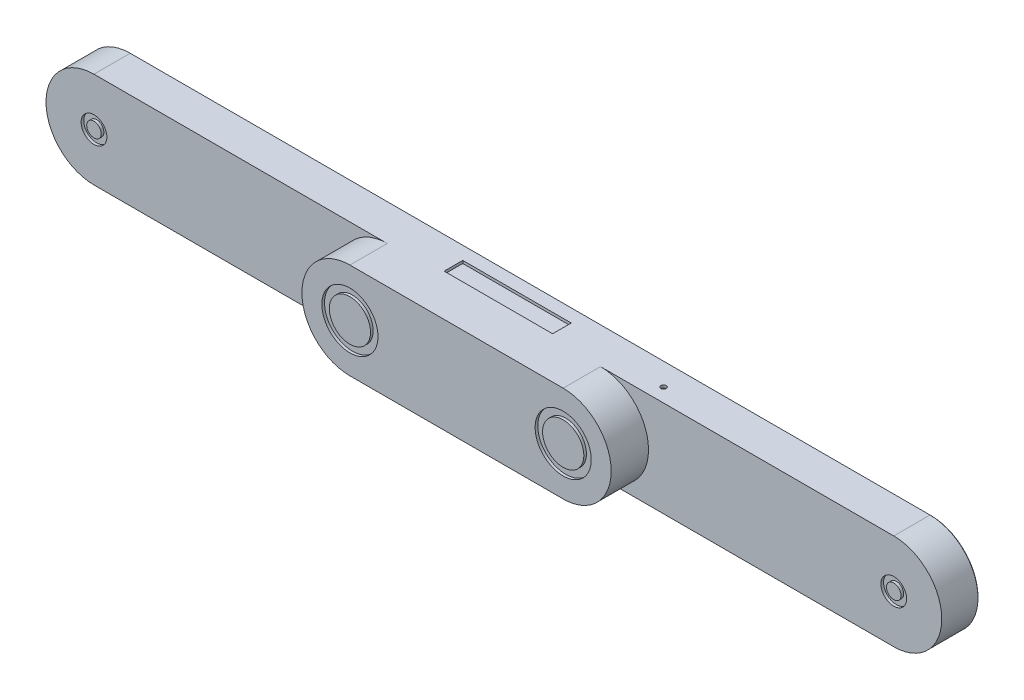
from build123d import *

# Parameters (mm, degrees)
EXTRUDE_1_DEPTH               = 7
EXTRUDE_2_DEPTH               = 7
SKETCH_3_R                    = 5.263772199
SKETCH_3_R_2                  = 3.86516819
CUT_EXTRUDE_1_DEPTH           = 0.5
SKETCH_4_R                    = 2.413361855
SKETCH_4_R_2                  = 1.363684761
CUT_EXTRUDE_2_DEPTH           = 0.5
SKETCH_5_R                    = 0.5
SKETCH_5_W                    = 20.341295444
SKETCH_5_H                    = 3.489253995
CUT_EXTRUDE_3_DEPTH           = 0.5
SKETCH_6_R                    = 1
CUT_EXTRUDE_4_DEPTH           = 5
CUT_EXTRUDE_5_DEPTH           = 0.5
CUT_EXTRUDE_5_DRAFT           = -45
CUT_EXTRUDE_5_PROFILE_2_DEPTH = 0.5
CUT_EXTRUDE_5_PROFILE_2_DRAFT = -45
CUT_EXTRUDE_5_PROFILE_3_DEPTH = 0.5
CUT_EXTRUDE_5_PROFILE_3_DRAFT = -45
CUT_EXTRUDE_5_PROFILE_4_DEPTH = 0.5
CUT_EXTRUDE_5_PROFILE_4_DRAFT = -45
CUT_EXTRUDE_5_PROFILE_5_DEPTH = 0.5
CUT_EXTRUDE_5_PROFILE_5_DRAFT = -45
CUT_EXTRUDE_5_PROFILE_6_DEPTH = 0.5
CUT_EXTRUDE_5_PROFILE_6_DRAFT = -45
WRAP_START                    = -0.01
WRAP_1_DEPTH                  = 0.01
CHAMFER_1_SIZE                = 0.2


# Read off the part's stored shape, not the designer's step: 包覆1
with BuildPart() as part:
    # 草图1 → 凸台-拉伸1 (new body)
    with BuildSketch(Plane.XY):
        with BuildLine():
            Line((-75, 9), (75, 9))
            ThreePointArc((75, 9), (84, 0), (75, -9))
            Line((75, -9), (-75, -9))
            ThreePointArc((-75, -9), (-84, 0), (-75, 9))
        make_face()
    extrude(amount=EXTRUDE_1_DEPTH)

    # 草图2 → 凸台-拉伸2 (add)
    with BuildSketch(Plane.XY.offset(7)):
        with BuildLine():
            Line((-20, 9), (20, 9))
            ThreePointArc((20, 9), (29, 0), (20, -9))
            Line((20, -9), (-20, -9))
            ThreePointArc((-20, -9), (-29, 0), (-20, 9))
        make_face()
    extrude(amount=EXTRUDE_2_DEPTH)

    # 草图3 → 切除-拉伸1 (cut)
    # profile 1 of 2: a face of its own
    with BuildSketch(Plane.XY.offset(14)):
        with Locations((-20, 0)):
            Circle(SKETCH_3_R)
        with Locations((-20, 0)):
            Circle(SKETCH_3_R_2, mode=Mode.SUBTRACT)
    # profile 2 of 2: a face of its own
    with BuildSketch(Plane.XY.offset(14)):
        with Locations(Location((20, 0, 0), (0, 0, 180))):
            Circle(SKETCH_3_R)
        with Locations(Location((20, 0, 0), (0, 0, 180))):
            Circle(SKETCH_3_R_2, mode=Mode.SUBTRACT)
    extrude(amount=-CUT_EXTRUDE_1_DEPTH, mode=Mode.SUBTRACT)

    # 草图4 → 切除-拉伸2 (cut)
    # profile 1 of 2: a face of its own
    with BuildSketch(Plane.XY.offset(7)):
        with Locations((-75, 0)):
            Circle(SKETCH_4_R)
        with Locations((-75, 0)):
            Circle(SKETCH_4_R_2, mode=Mode.SUBTRACT)
    # profile 2 of 2: a face of its own
    with BuildSketch(Plane.XY.offset(7)):
        with Locations(Location((75, 0, 0), (0, 0, 180))):
            Circle(SKETCH_4_R)
        with Locations(Location((75, 0, 0), (0, 0, 180))):
            Circle(SKETCH_4_R_2, mode=Mode.SUBTRACT)
    extrude(amount=-CUT_EXTRUDE_2_DEPTH, mode=Mode.SUBTRACT)

    # 草图5 → 切除-拉伸3 (cut)
    with BuildSketch(Plane(origin=(0, 9, 0), x_dir=(1, 0, 0), z_dir=(0, 1, 0))):
        with Locations(Location((29.23037992, -4.408801646, 0), (0, 0, 180))):
            Circle(SKETCH_5_R)
        with Locations((0, -4.408801646)):
            Rectangle(SKETCH_5_W, SKETCH_5_H)
    extrude(amount=-CUT_EXTRUDE_3_DEPTH, mode=Mode.SUBTRACT)

    # 草图6 → 切除-拉伸4 (cut)
    with BuildSketch(Plane(origin=(0, 0, 0), x_dir=(-1, 0, 0), z_dir=(0, 0, -1))):
        with Locations((-65, 6)):
            Circle(SKETCH_6_R)
        with Locations(Location((65, 6, 0), (0, 0, 180))):
            Circle(SKETCH_6_R)
        with Locations((65, -6)):
            Circle(SKETCH_6_R)
        with Locations(Location((-65, -6, 0), (0, 0, 180))):
            Circle(SKETCH_6_R)
    extrude(amount=-CUT_EXTRUDE_4_DEPTH, mode=Mode.SUBTRACT)


with BuildPart() as cut_extrude_5_tool:
    # 草图7 → 切除-拉伸5 (with draft: the straight prism first)
    with BuildSketch(Plane(origin=(0, 0, 0), x_dir=(-1, 0, 0), z_dir=(0, 0, -1))):
        Polygon((-74.422649731, -1), (-73.845299462, 0), (-74.422649731, 1), (-75.577350269, 1), (-76.154700538, 0), (-75.577350269, -1), align=None)
    extrude(amount=-CUT_EXTRUDE_5_DEPTH)
    # 切除-拉伸5: the draft: its side faces are tilted about the plane it starts from
    cut_extrude_5_sides = [cut_extrude_5_tool.faces().sort_by_distance(p)[0] for p in [
        (74.133974596, -0.5, 0.25),
        (74.133974596, 0.5, 0.25),
        (75, 1, 0.25),
        (75.866025404, 0.5, 0.25),
        (75.866025404, -0.5, 0.25),
        (75, -1, 0.25),
    ]]
    draft(cut_extrude_5_sides, Plane(origin=(0, 0, 0), x_dir=(-1, 0, 0), z_dir=(0, 0, -1)), CUT_EXTRUDE_5_DRAFT)


with BuildPart() as part_1:
    add(part.part)

    # 切除-拉伸5: cut by cut_extrude_5_tool
    add(cut_extrude_5_tool.part, mode=Mode.SUBTRACT)


with BuildPart() as cut_extrude_5_profile_2_tool:
    # 草图7 → 切除-拉伸5 profile 2 (with draft: the straight prism first)
    with BuildSketch(Plane(origin=(0, 0, 0), x_dir=(-1, 0, 0), z_dir=(0, 0, -1))):
        Polygon((42.135050103, -5.268835335), (43.289750642, -5.268835335), (43.867100911, -4.268835335), (43.289750642, -3.268835335), (42.135050103, -3.268835335), (41.557699834, -4.268835335), align=None)
    extrude(amount=-CUT_EXTRUDE_5_PROFILE_2_DEPTH)
    # 切除-拉伸5 profile 2: the draft: its side faces are tilted about the plane it starts from
    cut_extrude_5_profile_2_sides = [cut_extrude_5_profile_2_tool.faces().sort_by_distance(p)[0] for p in [
        (-42.712400373, -5.268835335, 0.25),
        (-43.578425776, -4.768835335, 0.25),
        (-43.578425776, -3.768835335, 0.25),
        (-42.712400373, -3.268835335, 0.25),
        (-41.846374969, -3.768835335, 0.25),
        (-41.846374969, -4.768835335, 0.25),
    ]]
    draft(cut_extrude_5_profile_2_sides, Plane(origin=(0, 0, 0), x_dir=(-1, 0, 0), z_dir=(0, 0, -1)), CUT_EXTRUDE_5_PROFILE_2_DRAFT)


with BuildPart() as part_2:
    add(part_1.part)

    # 切除-拉伸5 profile 2: cut by cut_extrude_5_profile_2_tool
    add(cut_extrude_5_profile_2_tool.part, mode=Mode.SUBTRACT)


with BuildPart() as cut_extrude_5_profile_3_tool:
    # 草图7 → 切除-拉伸5 profile 3 (with draft: the straight prism first)
    with BuildSketch(Plane(origin=(0, 0, 0), x_dir=(-1, 0, 0), z_dir=(0, 0, -1))):
        Polygon((-41.557699834, 5.451130792), (-42.135050103, 6.451130792), (-43.289750642, 6.451130792), (-43.867100911, 5.451130792), (-43.289750642, 4.451130792), (-42.135050103, 4.451130792), align=None)
    extrude(amount=-CUT_EXTRUDE_5_PROFILE_3_DEPTH)
    # 切除-拉伸5 profile 3: the draft: its side faces are tilted about the plane it starts from
    cut_extrude_5_profile_3_sides = [cut_extrude_5_profile_3_tool.faces().sort_by_distance(p)[0] for p in [
        (41.846374969, 5.951130792, 0.25),
        (42.712400373, 6.451130792, 0.25),
        (43.578425776, 5.951130792, 0.25),
        (43.578425776, 4.951130792, 0.25),
        (42.712400373, 4.451130792, 0.25),
        (41.846374969, 4.951130792, 0.25),
    ]]
    draft(cut_extrude_5_profile_3_sides, Plane(origin=(0, 0, 0), x_dir=(-1, 0, 0), z_dir=(0, 0, -1)), CUT_EXTRUDE_5_PROFILE_3_DRAFT)


with BuildPart() as part_3:
    add(part_2.part)

    # 切除-拉伸5 profile 3: cut by cut_extrude_5_profile_3_tool
    add(cut_extrude_5_profile_3_tool.part, mode=Mode.SUBTRACT)


with BuildPart() as cut_extrude_5_profile_4_tool:
    # 草图7 → 切除-拉伸5 profile 4 (with draft: the straight prism first)
    with BuildSketch(Plane(origin=(0, 0, 0), x_dir=(-1, 0, 0), z_dir=(0, 0, -1))):
        Polygon((-41.557699834, -4.268835335), (-42.135050103, -3.268835335), (-43.289750642, -3.268835335), (-43.867100911, -4.268835335), (-43.289750642, -5.268835335), (-42.135050103, -5.268835335), align=None)
    extrude(amount=-CUT_EXTRUDE_5_PROFILE_4_DEPTH)
    # 切除-拉伸5 profile 4: the draft: its side faces are tilted about the plane it starts from
    cut_extrude_5_profile_4_sides = [cut_extrude_5_profile_4_tool.faces().sort_by_distance(p)[0] for p in [
        (41.846374969, -3.768835335, 0.25),
        (42.712400373, -3.268835335, 0.25),
        (43.578425776, -3.768835335, 0.25),
        (43.578425776, -4.768835335, 0.25),
        (42.712400373, -5.268835335, 0.25),
        (41.846374969, -4.768835335, 0.25),
    ]]
    draft(cut_extrude_5_profile_4_sides, Plane(origin=(0, 0, 0), x_dir=(-1, 0, 0), z_dir=(0, 0, -1)), CUT_EXTRUDE_5_PROFILE_4_DRAFT)


with BuildPart() as part_4:
    add(part_3.part)

    # 切除-拉伸5 profile 4: cut by cut_extrude_5_profile_4_tool
    add(cut_extrude_5_profile_4_tool.part, mode=Mode.SUBTRACT)


with BuildPart() as cut_extrude_5_profile_5_tool:
    # 草图7 → 切除-拉伸5 profile 5 (with draft: the straight prism first)
    with BuildSketch(Plane(origin=(0, 0, 0), x_dir=(-1, 0, 0), z_dir=(0, 0, -1))):
        Polygon((42.135050103, 4.451130792), (43.289750642, 4.451130792), (43.867100911, 5.451130792), (43.289750642, 6.451130792), (42.135050103, 6.451130792), (41.557699834, 5.451130792), align=None)
    extrude(amount=-CUT_EXTRUDE_5_PROFILE_5_DEPTH)
    # 切除-拉伸5 profile 5: the draft: its side faces are tilted about the plane it starts from
    cut_extrude_5_profile_5_sides = [cut_extrude_5_profile_5_tool.faces().sort_by_distance(p)[0] for p in [
        (-42.712400373, 4.451130792, 0.25),
        (-43.578425776, 4.951130792, 0.25),
        (-43.578425776, 5.951130792, 0.25),
        (-42.712400373, 6.451130792, 0.25),
        (-41.846374969, 5.951130792, 0.25),
        (-41.846374969, 4.951130792, 0.25),
    ]]
    draft(cut_extrude_5_profile_5_sides, Plane(origin=(0, 0, 0), x_dir=(-1, 0, 0), z_dir=(0, 0, -1)), CUT_EXTRUDE_5_PROFILE_5_DRAFT)


with BuildPart() as part_5:
    add(part_4.part)

    # 切除-拉伸5 profile 5: cut by cut_extrude_5_profile_5_tool
    add(cut_extrude_5_profile_5_tool.part, mode=Mode.SUBTRACT)


with BuildPart() as cut_extrude_5_profile_6_tool:
    # 草图7 → 切除-拉伸5 profile 6 (with draft: the straight prism first)
    with BuildSketch(Plane(origin=(0, 0, 0), x_dir=(-1, 0, 0), z_dir=(0, 0, -1))):
        Polygon((75.577350269, -1), (76.154700538, 0), (75.577350269, 1), (74.422649731, 1), (73.845299462, 0), (74.422649731, -1), align=None)
    extrude(amount=-CUT_EXTRUDE_5_PROFILE_6_DEPTH)
    # 切除-拉伸5 profile 6: the draft: its side faces are tilted about the plane it starts from
    cut_extrude_5_profile_6_sides = [cut_extrude_5_profile_6_tool.faces().sort_by_distance(p)[0] for p in [
        (-75.866025404, -0.5, 0.25),
        (-75.866025404, 0.5, 0.25),
        (-75, 1, 0.25),
        (-74.133974596, 0.5, 0.25),
        (-74.133974596, -0.5, 0.25),
        (-75, -1, 0.25),
    ]]
    draft(cut_extrude_5_profile_6_sides, Plane(origin=(0, 0, 0), x_dir=(-1, 0, 0), z_dir=(0, 0, -1)), CUT_EXTRUDE_5_PROFILE_6_DRAFT)


with BuildPart() as part_6:
    add(part_5.part)

    # 切除-拉伸5 profile 6: cut by cut_extrude_5_profile_6_tool
    add(cut_extrude_5_profile_6_tool.part, mode=Mode.SUBTRACT)

    # 包覆1 outline → 包覆1 (cut)
    # profile 1 of 5: a face of its own
    with BuildSketch(Plane(origin=(0, 0, 0), x_dir=(-1, 0, 0), z_dir=(0, 0, -1)).offset(WRAP_START)):
        with BuildLine():
            add(Edge.make_bspline(
                [(-23.020357106, 0.2296875), (-23.02077942, 0.213405213), (-23.021588909, 0.182195475), (-23.034387077, 0.138032641), (-23.052112474, 0.097537483), (-23.079545966, 0.063665563), (-23.111521846, 0.034690041), (-23.150081733, 0.01514381), (-23.192908299, 0.001954286), (-23.223276263, 0.000669671), (-23.239107106, 0)],
                knots=[0, 0, 0, 0, 0.136554966, 0.261747299, 0.384490029, 0.506148384, 0.625808579, 0.745099071, 0.867119956, 1, 1, 1, 1], degree=3))
            Line((-23.020357106, 0.2296875), (-23.020357106, 1.054101563))
            add(Edge.make_bspline(
                [(-22.976607106, 2.130761719), (-22.976898943, 2.092477324), (-22.977515766, 2.011559843), (-22.981970866, 1.883485596), (-22.988739074, 1.742192064), (-22.998482125, 1.592089844), (-23.008225066, 1.441987624), (-23.014993568, 1.30069409), (-23.019439821, 1.172847582), (-23.020063129, 1.092158057), (-23.020357106, 1.054101563)],
                knots=[0, 0, 0, 0, 0.106568294, 0.225241589, 0.356692768, 0.500317122, 0.643941477, 0.775392656, 0.894065951, 1, 1, 1, 1], degree=3))
            add(Edge.make_bspline(
                [(-23.195357106, 2.3625), (-23.180029398, 2.361681405), (-23.150272562, 2.360092204), (-23.107452272, 2.348614336), (-23.069958003, 2.327140107), (-23.036717435, 2.299221779), (-23.010574637, 2.264023664), (-22.989550989, 2.224491642), (-22.979188744, 2.178889656), (-22.977489261, 2.147207199), (-22.976607106, 2.130761719)],
                knots=[0, 0, 0, 0, 0.128659322, 0.249776057, 0.367926716, 0.488665315, 0.611461807, 0.733780722, 0.86181299, 1, 1, 1, 1], degree=3))
            add(Edge.make_bspline(
                [(-23.414107106, 2.130761719), (-23.413324783, 2.147237619), (-23.411814963, 2.179034786), (-23.400105927, 2.224181223), (-23.380345551, 2.264231485), (-23.353912056, 2.299160837), (-23.320676085, 2.327386671), (-23.282884234, 2.348284407), (-23.240262216, 2.360216793), (-23.210698455, 2.361719967), (-23.195357106, 2.3625)],
                knots=[0, 0, 0, 0, 0.138263128, 0.266836758, 0.388367244, 0.511231377, 0.632036483, 0.751928691, 0.871269808, 1, 1, 1, 1], degree=3))
            add(Edge.make_bspline(
                [(-23.457857106, 1.054101563), (-23.457563129, 1.092158057), (-23.456939821, 1.172847582), (-23.452493568, 1.30069409), (-23.445725066, 1.441987624), (-23.435982125, 1.592089844), (-23.426239074, 1.742192064), (-23.419470866, 1.883485596), (-23.415015766, 2.011559843), (-23.414398943, 2.092477324), (-23.414107106, 2.130761719)],
                knots=[0, 0, 0, 0, 0.105934049, 0.224607344, 0.356058523, 0.499682878, 0.643307232, 0.774758411, 0.893431706, 1, 1, 1, 1], degree=3))
            Line((-23.457857106, 1.054101563), (-23.457857106, 0.2296875))
            add(Edge.make_bspline(
                [(-23.239107106, 0), (-23.254481565, 0.000684186), (-23.284173123, 0.002005504), (-23.326296562, 0.015258877), (-23.364672413, 0.03489429), (-23.397349768, 0.06338985), (-23.424550816, 0.097744845), (-23.443368006, 0.137830526), (-23.4557219, 0.182254536), (-23.457124817, 0.213419919), (-23.457857106, 0.2296875)],
                knots=[0, 0, 0, 0, 0.129477122, 0.250049616, 0.369727711, 0.491233762, 0.613287415, 0.737253567, 0.86285268, 1, 1, 1, 1], degree=3))
        make_face()
    # profile 2 of 5: a face of its own
    with BuildSketch(Plane(origin=(0, 0, 0), x_dir=(-1, 0, 0), z_dir=(0, 0, -1)).offset(WRAP_START)):
        with BuildLine():
            add(Edge.make_bspline(
                [(-23.414107106, 3.19375), (-23.413347731, 3.211434059), (-23.411867695, 3.245900612), (-23.395473731, 3.294900877), (-23.371566906, 3.340438497), (-23.337181288, 3.380120785), (-23.296500556, 3.413523606), (-23.251207645, 3.438524463), (-23.201772241, 3.453693272), (-23.167663885, 3.455385526), (-23.150239918, 3.45625)],
                knots=[0, 0, 0, 0, 0.128029489, 0.249531812, 0.371776588, 0.499838197, 0.628113743, 0.75260336, 0.873619514, 1, 1, 1, 1], degree=3))
            add(Edge.make_bspline(
                [(-23.150239918, 2.93125), (-23.167672624, 2.932098476), (-23.201798087, 2.933759414), (-23.251004184, 2.949125124), (-23.296702982, 2.973151039), (-23.337124526, 3.006765669), (-23.371804036, 3.046465998), (-23.395296056, 3.092469619), (-23.41189757, 3.141582776), (-23.413357861, 3.176060308), (-23.414107106, 3.19375)],
                knots=[0, 0, 0, 0, 0.126295102, 0.247229495, 0.37085115, 0.49904003, 0.62701512, 0.750636775, 0.87205701, 1, 1, 1, 1], degree=3))
            add(Edge.make_bspline(
                [(-22.889107106, 3.19375), (-22.889949949, 3.176094422), (-22.891589466, 3.141750422), (-22.906855603, 3.092111942), (-22.931659317, 3.046908122), (-22.965243458, 3.00670324), (-23.005049219, 2.973438535), (-23.049753589, 2.948800807), (-23.098710354, 2.933812992), (-23.132816885, 2.932116592), (-23.150239918, 2.93125)],
                knots=[0, 0, 0, 0, 0.128580339, 0.250117168, 0.375142405, 0.502686137, 0.630229869, 0.75153893, 0.873075759, 1, 1, 1, 1], degree=3))
            add(Edge.make_bspline(
                [(-23.150239918, 3.45625), (-23.132826046, 3.455367153), (-23.098737449, 3.453638931), (-23.049543554, 3.438849682), (-23.005256565, 3.413238488), (-22.965185343, 3.380184124), (-22.931894188, 3.339994786), (-22.906681016, 3.295260552), (-22.89162003, 3.245732255), (-22.889960327, 3.211399696), (-22.889107106, 3.19375)],
                knots=[0, 0, 0, 0, 0.127006889, 0.248622858, 0.370818088, 0.498444872, 0.626071655, 0.749719966, 0.871335935, 1, 1, 1, 1], degree=3))
        make_face()
    # profile 3 of 5: a face of its own
    with BuildSketch(Plane(origin=(0, 0, 0), x_dir=(-1, 0, 0), z_dir=(0, 0, -1)).offset(WRAP_START)):
        with BuildLine():
            add(Edge.make_bspline(
                [(-24.857857106, 2.115722656), (-24.857185546, 2.134271695), (-24.855866262, 2.170711388), (-24.841965292, 2.223173898), (-24.821469194, 2.272859239), (-24.792252472, 2.317720704), (-24.757578211, 2.357003874), (-24.716343083, 2.386068331), (-24.669779652, 2.403242994), (-24.637195218, 2.405237344), (-24.620650075, 2.40625)],
                knots=[0, 0, 0, 0, 0.133605296, 0.262468371, 0.389256972, 0.520213318, 0.647129901, 0.765314104, 0.880835377, 1, 1, 1, 1], degree=3))
            Line((-24.857857106, 2.115722656), (-24.770357106, 0.863378906))
            add(Edge.make_bspline(
                [(-24.682857106, -0.49765625), (-24.68281773, -0.485579222), (-24.682731544, -0.459144673), (-24.683513306, -0.416074288), (-24.684923101, -0.366628187), (-24.686784706, -0.31054986), (-24.690708155, -0.248389646), (-24.693574257, -0.179291331), (-24.698961766, -0.104157122), (-24.703137277, -0.022286977), (-24.709978299, 0.06582207), (-24.715425178, 0.16069307), (-24.723656254, 0.262010898), (-24.730537796, 0.369870135), (-24.739807068, 0.483986202), (-24.749306041, 0.604531562), (-24.759584476, 0.731678352), (-24.76670401, 0.818718059), (-24.770357106, 0.863378906)],
                knots=[0, 0, 0, 0, 0.026559892, 0.058135061, 0.09473128, 0.135350644, 0.181522645, 0.23169825, 0.287434184, 0.347171742, 0.411974657, 0.481777591, 0.556149408, 0.635519609, 0.719461507, 0.807938991, 0.901451789, 1, 1, 1, 1], degree=3))
            add(Edge.make_bspline(
                [(-24.751900075, -0.725292969), (-24.735164789, -0.687749612), (-24.702618667, -0.614736772), (-24.689318364, -0.535937008), (-24.682857106, -0.49765625)],
                knots=[0, 0, 0, 0, 0.514202122, 1, 1, 1, 1], degree=3))
            add(Edge.make_bspline(
                [(-24.923482106, -0.875), (-24.906879682, -0.873063067), (-24.87264626, -0.869069201), (-24.826303271, -0.836949663), (-24.784698801, -0.788660782), (-24.763532236, -0.747766544), (-24.751900075, -0.725292969)],
                knots=[0, 0, 0, 0, 0.206442947, 0.425675725, 0.68437804, 1, 1, 1, 1], degree=3))
            add(Edge.make_bspline(
                [(-25.129927418, -0.756738281), (-25.115144422, -0.774768252), (-25.087198841, -0.80885187), (-25.036063759, -0.846865826), (-24.981014509, -0.870550056), (-24.942615148, -0.873520121), (-24.923482106, -0.875)],
                knots=[0, 0, 0, 0, 0.282637376, 0.534293935, 0.767955151, 1, 1, 1, 1], degree=3))
            add(Edge.make_bspline(
                [(-25.258443043, -0.525683594), (-25.251262582, -0.540551477), (-25.235302139, -0.573599212), (-25.206233092, -0.626768478), (-25.170687445, -0.68898978), (-25.144151168, -0.733096546), (-25.129927418, -0.756738281)],
                knots=[0, 0, 0, 0, 0.187244695, 0.416200011, 0.687076471, 1, 1, 1, 1], degree=3))
            add(Edge.make_bspline(
                [(-25.540767262, -0.21875), (-25.529227649, -0.219719951), (-25.505292827, -0.221731768), (-25.470225508, -0.237765003), (-25.435155588, -0.262083282), (-25.400305386, -0.296567712), (-25.36463347, -0.340102887), (-25.328984609, -0.393464428), (-25.292517482, -0.455939142), (-25.270211728, -0.501595142), (-25.258443043, -0.525683594)],
                knots=[0, 0, 0, 0, 0.079356062, 0.164595917, 0.261818615, 0.372983349, 0.501380608, 0.649604883, 0.815128879, 1, 1, 1, 1], degree=3))
            add(Edge.make_bspline(
                [(-25.776607106, -0.452539062), (-25.7756382, -0.436951726), (-25.773750186, -0.406578174), (-25.760210674, -0.362570934), (-25.737049115, -0.322494545), (-25.705788579, -0.286688951), (-25.668711132, -0.257226844), (-25.628550051, -0.234548763), (-25.585379923, -0.22094648), (-25.555670902, -0.219483772), (-25.540767262, -0.21875)],
                knots=[0, 0, 0, 0, 0.127319193, 0.248094732, 0.372380767, 0.503087844, 0.634271763, 0.757647368, 0.878422908, 1, 1, 1, 1], degree=3))
            add(Edge.make_bspline(
                [(-25.749263356, -0.566699219), (-25.757219009, -0.546677094), (-25.771835849, -0.509890649), (-25.775113441, -0.470493248), (-25.776607106, -0.452539062)],
                knots=[0, 0, 0, 0, 0.544279933, 1, 1, 1, 1], degree=3))
            add(Edge.make_bspline(
                [(-24.931685231, -1.35625), (-24.951761835, -1.355465467), (-24.991874949, -1.353897968), (-25.051604775, -1.345173151), (-25.109606513, -1.329081158), (-25.166768931, -1.30770544), (-25.222206698, -1.279613876), (-25.276969826, -1.245965377), (-25.329559053, -1.205050027), (-25.381328498, -1.158610219), (-25.432397462, -1.106389869), (-25.481337458, -1.047356906), (-25.529295839, -0.982319738), (-25.57538773, -0.910935533), (-25.621703356, -0.83425804), (-25.665743929, -0.750760503), (-25.708983715, -0.661204659), (-25.735617875, -0.598714702), (-25.749263356, -0.566699219)],
                knots=[0, 0, 0, 0, 0.050001857, 0.099903856, 0.149857419, 0.199588227, 0.2515965, 0.304332927, 0.359362785, 0.417215033, 0.477390357, 0.541017716, 0.607960101, 0.678450054, 0.752487111, 0.830906338, 0.913368236, 1, 1, 1, 1], degree=3))
            add(Edge.make_bspline(
                [(-24.434028981, -1.074609375), (-24.451093022, -1.097118397), (-24.484136398, -1.140705614), (-24.540358067, -1.197742891), (-24.598330285, -1.246536282), (-24.659200035, -1.287211951), (-24.723578913, -1.317842377), (-24.790682403, -1.339743766), (-24.860190287, -1.35433697), (-24.907685468, -1.355607825), (-24.931685231, -1.35625)],
                knots=[0, 0, 0, 0, 0.142277619, 0.275511097, 0.40274525, 0.523824621, 0.643550251, 0.760893153, 0.879177055, 1, 1, 1, 1], degree=3))
            add(Edge.make_bspline(
                [(-24.245357106, -0.49765625), (-24.245820313, -0.523886339), (-24.246737399, -0.575818219), (-24.2559728, -0.652870799), (-24.270943389, -0.727811127), (-24.291692928, -0.801200577), (-24.318175187, -0.872543043), (-24.350715303, -0.942203439), (-24.388737761, -1.010130619), (-24.418836052, -1.052979991), (-24.434028981, -1.074609375)],
                knots=[0, 0, 0, 0, 0.127395181, 0.252224509, 0.376418895, 0.498382539, 0.622389267, 0.745722041, 0.871646298, 1, 1, 1, 1], degree=3))
            Line((-24.245357106, -0.49765625), (-24.304146168, 0.91328125))
            Line((-24.304146168, 0.91328125), (-24.376607106, 2.231933594))
            add(Edge.make_bspline(
                [(-24.620650075, 2.40625), (-24.607360202, 2.405612507), (-24.580114793, 2.40430559), (-24.539783767, 2.392605466), (-24.499379293, 2.37463504), (-24.461361827, 2.349606437), (-24.426780098, 2.322511365), (-24.399920248, 2.293606531), (-24.381815936, 2.263537988), (-24.378292071, 2.242157062), (-24.376607106, 2.231933594)],
                knots=[0, 0, 0, 0, 0.123979978, 0.254169887, 0.389534908, 0.536050561, 0.678405439, 0.799029224, 0.903904144, 1, 1, 1, 1], degree=3))
        make_face()
    # profile 4 of 5: a face of its own
    with BuildSketch(Plane(origin=(0, 0, 0), x_dir=(-1, 0, 0), z_dir=(0, 0, -1)).offset(WRAP_START)):
        with BuildLine():
            add(Edge.make_bspline(
                [(-24.945357106, 3.192382812), (-24.944502419, 3.210039175), (-24.942829271, 3.244603561), (-24.927617283, 3.29432555), (-24.903604531, 3.340090508), (-24.869869201, 3.380113379), (-24.82981285, 3.413477932), (-24.785044049, 3.438672537), (-24.735744882, 3.453670059), (-24.701644292, 3.455377678), (-24.684224293, 3.45625)],
                knots=[0, 0, 0, 0, 0.128187465, 0.250941881, 0.374799753, 0.501953779, 0.629107805, 0.752298096, 0.873463572, 1, 1, 1, 1], degree=3))
            add(Edge.make_bspline(
                [(-24.684224293, 2.93125), (-24.701644162, 2.932122396), (-24.735744497, 2.933830159), (-24.785045524, 2.948826628), (-24.82980713, 2.974025306), (-24.869891313, 3.007374103), (-24.903392954, 3.047300666), (-24.927633676, 3.092446644), (-24.942754751, 3.14130154), (-24.944480955, 3.175184958), (-24.945357106, 3.192382812)],
                knots=[0, 0, 0, 0, 0.127345465, 0.249285638, 0.373263572, 0.501230583, 0.629197595, 0.752375772, 0.874315945, 1, 1, 1, 1], degree=3))
            add(Edge.make_bspline(
                [(-24.420357106, 3.192382812), (-24.421174625, 3.175169463), (-24.422788498, 3.141188423), (-24.438841479, 3.092393157), (-24.463720946, 3.047265833), (-24.49789487, 3.007320875), (-24.538560717, 2.974211204), (-24.583384201, 2.948801184), (-24.632709016, 2.933836804), (-24.666806091, 2.932124643), (-24.684224293, 2.93125)],
                knots=[0, 0, 0, 0, 0.125226972, 0.247211779, 0.370738834, 0.499308974, 0.628093898, 0.751620954, 0.87311766, 1, 1, 1, 1], degree=3))
            add(Edge.make_bspline(
                [(-24.684224293, 3.45625), (-24.66680596, 3.455375433), (-24.63270863, 3.453663422), (-24.583385679, 3.438697952), (-24.53855496, 3.413292163), (-24.497917358, 3.380165975), (-24.463507559, 3.340129712), (-24.438856435, 3.294378533), (-24.422710861, 3.244715979), (-24.421151927, 3.210054788), (-24.420357106, 3.192382812)],
                knots=[0, 0, 0, 0, 0.126081118, 0.24681061, 0.369557631, 0.497529319, 0.625287579, 0.749482307, 0.872273785, 1, 1, 1, 1], degree=3))
        make_face()
    # profile 5 of 5: a face of its own
    with BuildSketch(Plane(origin=(0, 0, 0), x_dir=(-1, 0, 0), z_dir=(0, 0, -1)).offset(WRAP_START)):
        with BuildLine():
            add(Edge.make_bspline(
                [(-26.126607106, 1.371972656), (-26.126307613, 1.310447664), (-26.125726327, 1.191033979), (-26.122321867, 1.017838975), (-26.116883169, 0.856265882), (-26.109674865, 0.706274063), (-26.099434164, 0.567931802), (-26.087109309, 0.441214986), (-26.073448871, 0.32617071), (-26.060823971, 0.253796386), (-26.054829762, 0.219433594)],
                knots=[0, 0, 0, 0, 0.159648833, 0.30986197, 0.449483198, 0.579135829, 0.699492038, 0.809394599, 0.909501967, 1, 1, 1, 1], degree=3))
            add(Edge.make_bspline(
                [(-26.096528981, 2.045996094), (-26.105301765, 1.933714752), (-26.122829924, 1.709374887), (-26.125348879, 1.484365573), (-26.126607106, 1.371972656)],
                knots=[0, 0, 0, 0, 0.500496606, 1, 1, 1, 1], degree=3))
            add(Edge.make_bspline(
                [(-25.995357106, 3.452832031), (-25.995611145, 3.438477141), (-25.996151476, 3.40794495), (-25.996447131, 3.359161273), (-25.998862977, 3.304484415), (-26.001572609, 3.243645795), (-26.004755415, 3.176622849), (-26.010069132, 3.103765973), (-26.014312955, 3.024859918), (-26.020888305, 2.939908868), (-26.027512402, 2.848975821), (-26.035176089, 2.751915824), (-26.04335508, 2.649147445), (-26.052039267, 2.539962673), (-26.06276424, 2.424970923), (-26.072460631, 2.303886082), (-26.084505451, 2.177022785), (-26.092451386, 2.090431775), (-26.096528981, 2.045996094)],
                knots=[0, 0, 0, 0, 0.030530485, 0.064936935, 0.103728168, 0.146896636, 0.194444284, 0.246401946, 0.302228311, 0.362470542, 0.427580771, 0.496109891, 0.569507596, 0.646808102, 0.729018946, 0.815091692, 0.905111088, 1, 1, 1, 1], degree=3))
            add(Edge.make_bspline(
                [(-26.217525075, 3.675), (-26.200162771, 3.674406448), (-26.16737153, 3.673285439), (-26.12118784, 3.663336278), (-26.082311801, 3.645174421), (-26.04926843, 3.621088675), (-26.025182685, 3.588045305), (-26.007020828, 3.549169266), (-25.997071667, 3.502985576), (-25.995950658, 3.470194334), (-25.995357106, 3.452832031)],
                knots=[0, 0, 0, 0, 0.14458455, 0.27306901, 0.390274216, 0.5, 0.609725784, 0.72693099, 0.85541545, 1, 1, 1, 1], degree=3))
            add(Edge.make_bspline(
                [(-26.439693043, 3.469921875), (-26.436808492, 3.486017187), (-26.431297149, 3.516769561), (-26.415002049, 3.558632289), (-26.395673206, 3.595230078), (-26.369536526, 3.624718635), (-26.338494987, 3.647500507), (-26.302359142, 3.663541934), (-26.261538499, 3.673104616), (-26.232618135, 3.674350036), (-26.217525075, 3.675)],
                knots=[0, 0, 0, 0, 0.145840897, 0.278649698, 0.399944032, 0.513972316, 0.627654313, 0.74162799, 0.865159915, 1, 1, 1, 1], degree=3))
            add(Edge.make_bspline(
                [(-26.520357106, 2.164257812), (-26.517437564, 2.241733381), (-26.51184712, 2.390086402), (-26.503160757, 2.602705352), (-26.49367194, 2.795718927), (-26.483378486, 2.968886284), (-26.473189388, 3.12225036), (-26.463099916, 3.255816014), (-26.452727562, 3.369616215), (-26.443747024, 3.438724929), (-26.439693043, 3.469921875)],
                knots=[0, 0, 0, 0, 0.177749399, 0.340360983, 0.487862214, 0.620785694, 0.738067752, 0.840238769, 0.92788084, 1, 1, 1, 1], degree=3))
            Line((-26.520357106, 2.164257812), (-26.735689137, 2.323535156))
            add(Edge.make_bspline(
                [(-27.146528981, 2.40625), (-27.104774076, 2.405200633), (-27.025752119, 2.403214686), (-26.914729302, 2.388636498), (-26.817821593, 2.364050431), (-26.761997704, 2.336512959), (-26.735689137, 2.323535156)],
                knots=[0, 0, 0, 0, 0.295821567, 0.559847987, 0.792566066, 1, 1, 1, 1], degree=3))
            add(Edge.make_bspline(
                [(-28.314107106, 1.057519531), (-28.31336842, 1.107243214), (-28.311924368, 1.204447669), (-28.29539386, 1.346295985), (-28.270781289, 1.480659139), (-28.234962071, 1.607408338), (-28.189270026, 1.726437189), (-28.13360507, 1.838423141), (-28.067214528, 1.942341092), (-27.991104623, 2.038020317), (-27.907848501, 2.124773955), (-27.816678813, 2.199719756), (-27.719995764, 2.263899986), (-27.616890497, 2.315910215), (-27.507844465, 2.356854764), (-27.392592899, 2.384870155), (-27.271559377, 2.403687773), (-27.188757876, 2.40538461), (-27.146528981, 2.40625)],
                knots=[0, 0, 0, 0, 0.074350557, 0.145347348, 0.213340259, 0.278519162, 0.342077872, 0.403818917, 0.465284567, 0.52618806, 0.58645575, 0.644810313, 0.702388083, 0.759708975, 0.81720091, 0.876231579, 0.936877911, 1, 1, 1, 1], degree=3))
            add(Edge.make_bspline(
                [(-27.990083668, 0.228320313), (-28.016040921, 0.255557616), (-28.067557363, 0.309614528), (-28.132752092, 0.400239835), (-28.189800335, 0.495336479), (-28.234484897, 0.597389719), (-28.270521611, 0.704363378), (-28.295276661, 0.817149392), (-28.31192072, 0.935343511), (-28.313367967, 1.016216199), (-28.314107106, 1.057519531)],
                knots=[0, 0, 0, 0, 0.123272154, 0.244653882, 0.365269292, 0.486381516, 0.609279275, 0.734930033, 0.864623359, 1, 1, 1, 1], degree=3))
            add(Edge.make_bspline(
                [(-27.196431325, -0.0875), (-27.235451377, -0.086685769), (-27.312197788, -0.085084301), (-27.424721305, -0.069318531), (-27.532542835, -0.045305876), (-27.634611108, -0.009837714), (-27.73226238, 0.033729387), (-27.823743971, 0.088990213), (-27.910769688, 0.153344777), (-27.963452276, 0.203145647), (-27.990083668, 0.228320313)],
                knots=[0, 0, 0, 0, 0.133290713, 0.262162226, 0.38761118, 0.5102657, 0.630863012, 0.752409717, 0.874841494, 1, 1, 1, 1], degree=3))
            add(Edge.make_bspline(
                [(-26.476607106, 0.1640625), (-26.504391163, 0.144556718), (-26.559271987, 0.106027667), (-26.644993494, 0.055162294), (-26.732747723, 0.012276576), (-26.821546314, -0.024399803), (-26.912550201, -0.052813042), (-27.005536849, -0.072158249), (-27.10035937, -0.085246749), (-27.164258503, -0.086745426), (-27.196431325, -0.0875)],
                knots=[0, 0, 0, 0, 0.131249212, 0.259251727, 0.38496502, 0.508673447, 0.630471545, 0.753006934, 0.875640505, 1, 1, 1, 1], degree=3))
            add(Edge.make_bspline(
                [(-26.265376637, -0.04375), (-26.277063288, -0.043073069), (-26.29993402, -0.041748319), (-26.333105253, -0.031793716), (-26.363462683, -0.014841618), (-26.392007292, 0.007969476), (-26.417207034, 0.037952278), (-26.439823258, 0.074210413), (-26.460349614, 0.116578931), (-26.471022137, 0.147750374), (-26.476607106, 0.1640625)],
                knots=[0, 0, 0, 0, 0.110004945, 0.21527925, 0.322869933, 0.435850755, 0.557625679, 0.689833232, 0.837688631, 1, 1, 1, 1], degree=3))
            add(Edge.make_bspline(
                [(-26.0507282, 0.166796875), (-26.051427481, 0.152101522), (-26.052787406, 0.123522786), (-26.066045105, 0.08301761), (-26.085589124, 0.045654893), (-26.115013935, 0.015056504), (-26.147886076, -0.011190584), (-26.18479196, -0.029519434), (-26.223971143, -0.042351096), (-26.251370289, -0.043276789), (-26.265376637, -0.04375)],
                knots=[0, 0, 0, 0, 0.131471619, 0.255678973, 0.379244773, 0.506644271, 0.633467856, 0.755123081, 0.874819771, 1, 1, 1, 1], degree=3))
            add(Edge.make_bspline(
                [(-26.054829762, 0.219433594), (-26.053454075, 0.209880692), (-26.050939555, 0.192419631), (-26.050794084, 0.174784067), (-26.0507282, 0.166796875)],
                knots=[0, 0, 0, 0, 0.547097456, 1, 1, 1, 1], degree=3))
        make_face()
        with BuildLine():
            add(Edge.make_bspline(
                [(-27.920357106, 1.064355469), (-27.919625772, 1.040406087), (-27.91817815, 0.99300005), (-27.908929279, 0.923183147), (-27.891257683, 0.856274467), (-27.867922789, 0.791764073), (-27.838833412, 0.729333452), (-27.801863362, 0.67009065), (-27.758797836, 0.613169864), (-27.709235572, 0.559960753), (-27.655613539, 0.510880285), (-27.598926973, 0.467776014), (-27.539801524, 0.430990821), (-27.478085116, 0.40196504), (-27.414710271, 0.37805677), (-27.348857083, 0.361839685), (-27.280580504, 0.352050905), (-27.234289632, 0.350690637), (-27.210786793, 0.35)],
                knots=[0, 0, 0, 0, 0.064346679, 0.127369513, 0.188686674, 0.249875372, 0.31148516, 0.3733226, 0.437107799, 0.502951112, 0.568380536, 0.632165735, 0.694003175, 0.755060069, 0.815098942, 0.875672168, 0.936876173, 1, 1, 1, 1], degree=3))
            add(Edge.make_bspline(
                [(-27.141060231, 1.96875), (-27.172545388, 1.968221977), (-27.233668395, 1.967196912), (-27.322082828, 1.955631402), (-27.404870453, 1.939041117), (-27.481660661, 1.914702232), (-27.552028922, 1.881983382), (-27.616680425, 1.843343341), (-27.674611544, 1.796690758), (-27.727179415, 1.743871048), (-27.772962628, 1.683184509), (-27.812759623, 1.615726905), (-27.846394636, 1.54122981), (-27.873599475, 1.459420337), (-27.894545306, 1.370614238), (-27.909226807, 1.274829132), (-27.919318988, 1.172122675), (-27.920003456, 1.101067954), (-27.920357106, 1.064355469)],
                knots=[0, 0, 0, 0, 0.069015203, 0.133981127, 0.195242687, 0.254038832, 0.310168182, 0.365110141, 0.418810573, 0.472881837, 0.528159198, 0.585072963, 0.644345113, 0.707089184, 0.773882607, 0.844217079, 0.919510231, 1, 1, 1, 1], degree=3))
            add(Edge.make_bspline(
                [(-26.556587575, 1.601660156), (-26.571742355, 1.630853614), (-26.60117531, 1.687551876), (-26.657380545, 1.762474827), (-26.719917783, 1.826631038), (-26.790654303, 1.878202038), (-26.867881918, 1.919221058), (-26.95263041, 1.94770376), (-27.044321379, 1.966276681), (-27.108151886, 1.967908633), (-27.141060231, 1.96875)],
                knots=[0, 0, 0, 0, 0.134545097, 0.261307632, 0.382097216, 0.500276164, 0.618440366, 0.738879588, 0.865377214, 1, 1, 1, 1], degree=3))
            Line((-26.556587575, 1.601660156), (-26.561372731, 1.333691406))
            Line((-26.561372731, 1.333691406), (-26.564107106, 1.071191406))
            Line((-26.564107106, 1.071191406), (-26.556587575, 0.678808594))
            add(Edge.make_bspline(
                [(-26.624263356, 0.608398438), (-26.6126071, 0.61885426), (-26.588311284, 0.640647943), (-26.567443664, 0.665749735), (-26.556587575, 0.678808594)],
                knots=[0, 0, 0, 0, 0.479763901, 1, 1, 1, 1], degree=3))
            add(Edge.make_bspline(
                [(-26.8819782, 0.420410156), (-26.8665749, 0.429311042), (-26.83074696, 0.450014422), (-26.773056181, 0.491499267), (-26.701848044, 0.544346172), (-26.651631095, 0.585804215), (-26.624263356, 0.608398438)],
                knots=[0, 0, 0, 0, 0.167017102, 0.388480305, 0.666727829, 1, 1, 1, 1], degree=3))
            add(Edge.make_bspline(
                [(-27.210786793, 0.35), (-27.17950241, 0.350581486), (-27.119113217, 0.351703947), (-27.032794445, 0.366040162), (-26.953326508, 0.387033739), (-26.905410272, 0.409448738), (-26.8819782, 0.420410156)],
                knots=[0, 0, 0, 0, 0.276233314, 0.533221539, 0.771735273, 1, 1, 1, 1], degree=3))
        make_face(mode=Mode.SUBTRACT)
    extrude(amount=WRAP_1_DEPTH, mode=Mode.SUBTRACT)

    # 倒角1
    chamfer_1_edges = [part_6.edges().sort_by_distance(p)[0] for p in [
        (0, 9, 0),
        (84, 0, 0),
        (0, -9, 0),
        (-84, 0, 0),
    ]]
    chamfer(chamfer_1_edges, length=CHAMFER_1_SIZE)


solid = part_6.part
